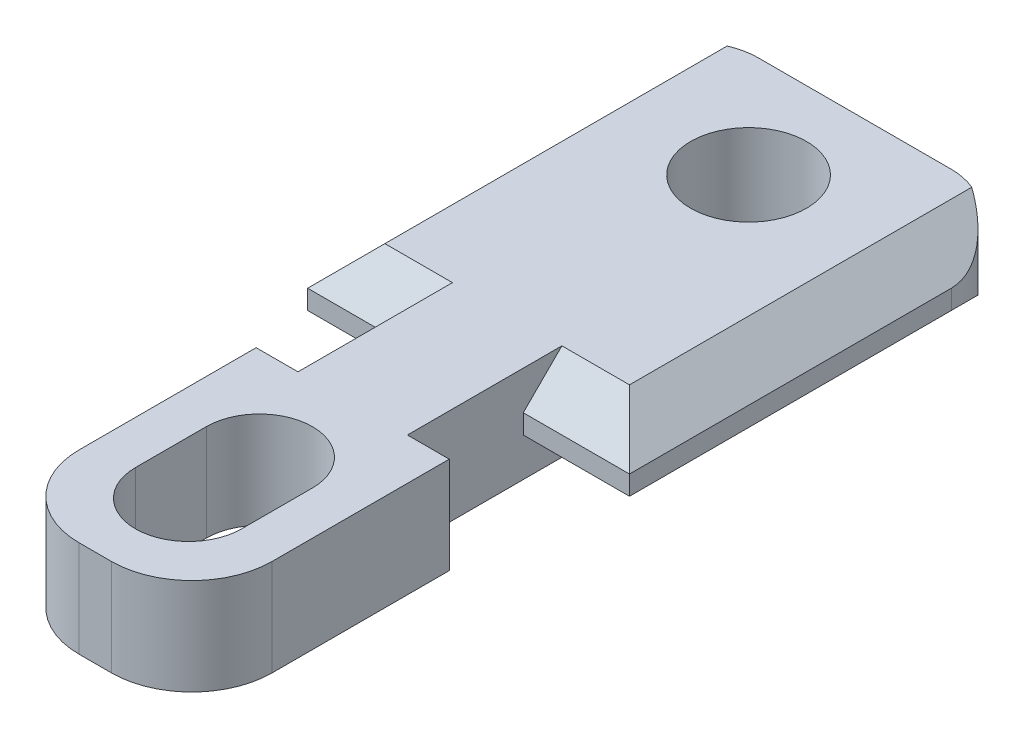
from build123d import *
from OCP.BRepFilletAPI import BRepFilletAPI_MakeFillet

# Parameters (mm, degrees)
SKETCH1_W               = 6
SKETCH1_H               = 8
BOSS_EXTRUDE1_DEPTH     = 1.5
SKETCH2_W               = 3.4
SKETCH2_H               = 3.6
BOSS_EXTRUDE2_DEPTH     = 1.5
SKETCH3_W               = 10
SKETCH3_H               = 12
BOSS_EXTRUDE3_DEPTH     = 1.5
FILLET1_R1              = 2
FILLET1_R2              = 2.5
CUT_EXTRUDE2_DEPTH      = 21.283244316
CUT_EXTRUDE2_DEPTH_BACK = 21.283244316
SKETCH5_R               = 1.8
CHAMFER3_SIZE           = 1.2


with BuildPart() as part:
    # Sketch1 → Boss-Extrude1 (new, symmetric)
    with BuildSketch(Plane(origin=(0, 0, 0), x_dir=(1, 0, 0), z_dir=(0, 1, 0))):
        Rectangle(SKETCH1_W, SKETCH1_H)
    extrude(amount=BOSS_EXTRUDE1_DEPTH, both=True)

    # Sketch2 → Boss-Extrude2 (add, symmetric)
    with BuildSketch(Plane(origin=(0, 0, 0), x_dir=(1, 0, 0), z_dir=(0, 1, 0))):
        with Locations((0, 5.8)):
            Rectangle(SKETCH2_W, SKETCH2_H)
    extrude(amount=BOSS_EXTRUDE2_DEPTH, both=True)

    # Sketch3 → Boss-Extrude3 (add, symmetric)
    with BuildSketch(Plane(origin=(0, 0, 0), x_dir=(1, 0, 0), z_dir=(0, 1, 0))):
        with Locations((0, 13.6)):
            Rectangle(SKETCH3_W, SKETCH3_H)
    extrude(amount=BOSS_EXTRUDE3_DEPTH, both=True)

    # Fillet1: one fillet with a radius per group of edges: ONE call of the kernel's fillet builder (fillet() takes one radius for all edges)
    fillet1_edges_1 = [part.edges().sort_by_distance(p)[0] for p in [
        (-5, 0, -19.6),
        (5, 0, -19.6),
    ]]
    fillet1_edges_2 = [part.edges().sort_by_distance(p)[0] for p in [
        (-3, 0, 4),
        (3, 0, 4),
    ]]
    fillet1 = BRepFilletAPI_MakeFillet(part.part.solid().wrapped)
    for e in fillet1_edges_1:
        fillet1.Add(FILLET1_R1, e.wrapped)
    for e in fillet1_edges_2:
        fillet1.Add(FILLET1_R2, e.wrapped)
    add(Compound.cast(fillet1.Shape()), mode=Mode.REPLACE)

    # Sketch5 → Cut-Extrude2 (cut, two sides: drawn at the far end of the back side and taken through both)
    with BuildSketch(Plane(origin=(0, 0, 0), x_dir=(1, 0, 0), z_dir=(0, 1, 0)).offset(-CUT_EXTRUDE2_DEPTH_BACK)):
        with Locations(Location((0, 16.3, 0), (0, 0, 270))):
            Circle(SKETCH5_R)
        with BuildLine():
            Line((-1.65, -1.1), (-1.65, 1.1))
            ThreePointArc((-1.65, 1.1), (0, 2.75), (1.65, 1.1))
            Line((1.65, 1.1), (1.65, -1.1))
            ThreePointArc((1.65, -1.1), (0, -2.75), (-1.65, -1.1))
        make_face()
    extrude(amount=CUT_EXTRUDE2_DEPTH + CUT_EXTRUDE2_DEPTH_BACK, mode=Mode.SUBTRACT)

    # Chamfer3
    # the kernel refuses this chamfer: 1.2 mm, written as the material it takes off along each edge
    with BuildSketch(Plane(origin=(8.086019586, -1.5, -7.6), x_dir=(0, 0.9996219169112968, 0.027495876610586632), z_dir=(-1, 0, 0)), Plane(origin=(-1.7, -1.5, -7.6), x_dir=(0, 0.9996219169112968, 0.027495876610586632), z_dir=(-1, 0, 0)), Plane(origin=(-1.7, 1.5, -7.6), x_dir=(0, 0.027495876610586483, -0.9996219169112968), z_dir=(-1, 0, 0)), Plane(origin=(8.086019586, 1.5, -7.6), x_dir=(0, 0.027495876610586483, -0.9996219169112968), z_dir=(-1, 0, 0))) as chamfer3_piece_1:
        Polygon((CHAMFER3_SIZE * 0.999621916911, CHAMFER3_SIZE * 0.0274958766106), (-CHAMFER3_SIZE * 0.0274958766106, CHAMFER3_SIZE * 0.999621916911), (0, 0), align=None)
    extrude(amount=6.386019586, mode=Mode.SUBTRACT)
    with BuildSketch(Plane(origin=(5, -1.5, -20.686019586), x_dir=(0.027495876610586632, 0.9996219169112968, 0), z_dir=(0, 0, 1)), Plane(origin=(5, 1.5, -20.686019586), x_dir=(-0.9996219169112968, 0.027495876610586452, 0), z_dir=(0, 0, 1)), Plane(origin=(-5, -1.5, -4.513980414), x_dir=(-0.027495876610586632, 0.9996219169112968, 0), z_dir=(0, 0, -1)), Plane(origin=(-5, 1.5, -4.513980414), x_dir=(0.9996219169112968, 0.027495876610586452, 0), z_dir=(0, 0, -1))) as chamfer3_piece_2:
        Polygon((CHAMFER3_SIZE * 0.999621916911, CHAMFER3_SIZE * 0.0274958766106), (-CHAMFER3_SIZE * 0.0274958766106, CHAMFER3_SIZE * 0.999621916911), (0, 0), align=None)
    extrude(amount=16.172039171, mode=Mode.SUBTRACT)


solid = part.part
